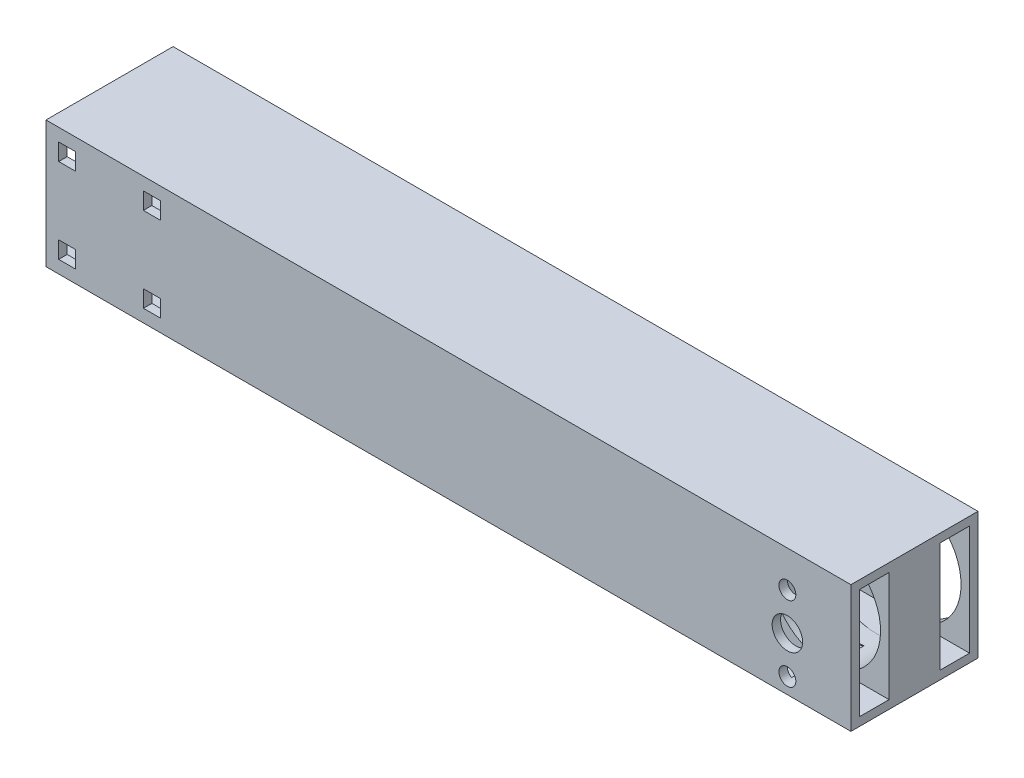
from build123d import *

# Parameters (mm, degrees)
BOSS_EXTRUDE3_DEPTH      = 110
BOSS_EXTRUDE3_DEPTH_BACK = 80
SKETCH1_W                = 30
SKETCH1_H                = 30
SKETCH1_W_2              = 7
SKETCH1_H_2              = 26
SKETCH6_R                = 13
CUT_EXTRUDE5_DEPTH       = 23
SKETCH8_R                = 3.6
SKETCH8_R_2              = 2
CUT_EXTRUDE6_DEPTH       = 17
SKETCH9_W                = 12
SKETCH9_H                = 26
CUT_EXTRUDE7_DEPTH       = 106
SKETCH12_W               = 4
SKETCH12_H               = 4
SKETCH12_W_2             = 4.027296216
CUT_EXTRUDE8_DEPTH       = 40


with BuildPart() as part:
    # Sketch1 → Boss-Extrude3 (new, two sides: drawn at the far end of the back side and taken through both)
    with BuildSketch(Plane(origin=(0, 0, 0), x_dir=(0, 0, -1), z_dir=(1, 0, 0)).offset(-BOSS_EXTRUDE3_DEPTH_BACK)):
        Rectangle(SKETCH1_W, SKETCH1_H)
        with Locations((-9.5, 0)):
            Rectangle(SKETCH1_W_2, SKETCH1_H_2, mode=Mode.SUBTRACT)
        with Locations((9.5, 0)):
            Rectangle(SKETCH1_W_2, SKETCH1_H_2, mode=Mode.SUBTRACT)
    extrude(amount=BOSS_EXTRUDE3_DEPTH + BOSS_EXTRUDE3_DEPTH_BACK)

    # Sketch6 → Cut-Extrude5 (cut)
    with BuildSketch(Plane(origin=(0, 0, -15), x_dir=(-1, 0, 0), z_dir=(0, 0, -1))):
        with Locations((-95, 0)):
            Circle(SKETCH6_R)
    extrude(amount=-CUT_EXTRUDE5_DEPTH, mode=Mode.SUBTRACT)

    # Sketch8 → Cut-Extrude6 (cut)
    with BuildSketch(Plane.XY.offset(15)):
        with Locations((95, -2.425625079)):
            Circle(SKETCH8_R)
        with Locations((95, 6.424374921)):
            Circle(SKETCH8_R_2)
        with Locations((95, -11.275625079)):
            Circle(SKETCH8_R_2)
    extrude(amount=-CUT_EXTRUDE6_DEPTH, mode=Mode.SUBTRACT)

    # Sketch9 → Cut-Extrude7 (cut)
    with BuildSketch(Plane.ZY.offset(80)):
        Rectangle(SKETCH9_W, SKETCH9_H)
    extrude(amount=-CUT_EXTRUDE7_DEPTH, mode=Mode.SUBTRACT)

    # Sketch12 → Cut-Extrude8 (cut)
    with BuildSketch(Plane.XY.offset(15)):
        with Locations((-75, 10)):
            Rectangle(SKETCH12_W, SKETCH12_H)
        with Locations((-55, 10)):
            Rectangle(SKETCH12_W_2, SKETCH12_H)
        with Locations((-55, -10)):
            Rectangle(SKETCH12_W, SKETCH12_H)
        with Locations((-75, -10)):
            Rectangle(SKETCH12_W, SKETCH12_H)
    extrude(amount=-CUT_EXTRUDE8_DEPTH, mode=Mode.SUBTRACT)


solid = part.part
